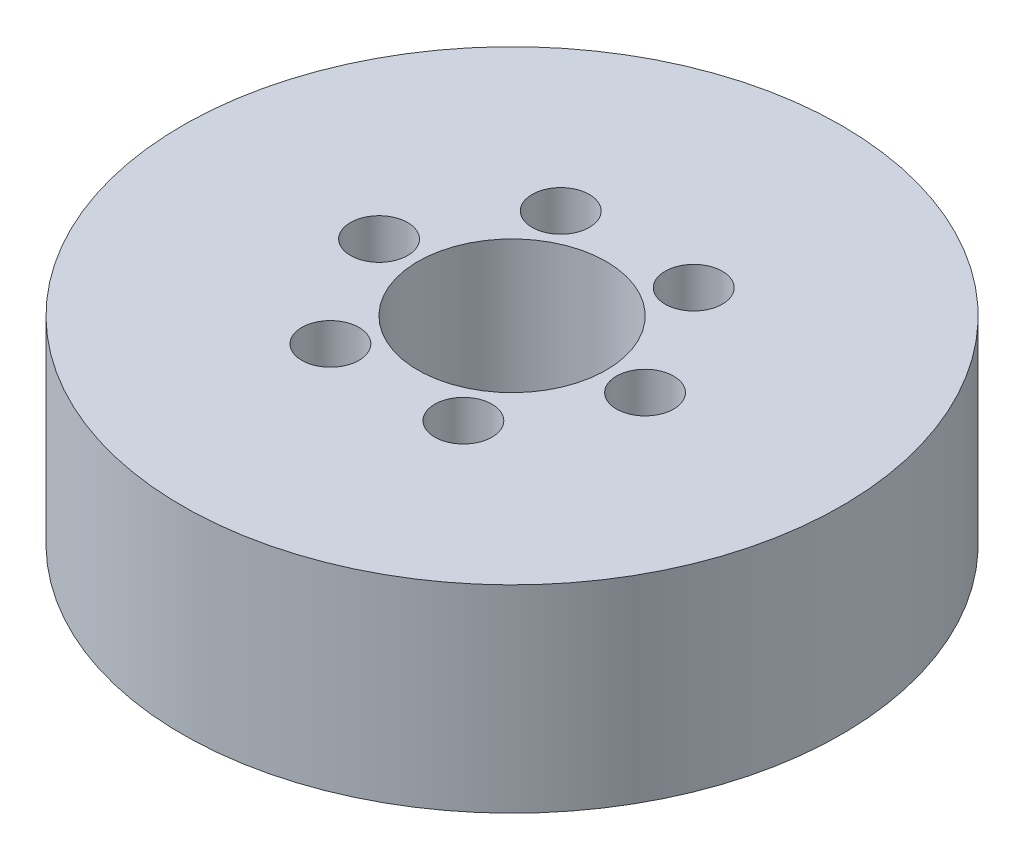
from build123d import *

# Parameters (mm, degrees)
SKETCH1_R           = 35
BOSS_EXTRUDE1_DEPTH = 21
SKETCH2_R           = 10
CUT_EXTRUDE1_DEPTH  = 54.768020235
SKETCH3_R           = 3.037598175
CUT_EXTRUDE2_DEPTH  = 18.811832248
CIRPATTERN1_COUNT   = 6


with BuildPart() as part:
    # Sketch1 → Boss-Extrude1 (new body)
    with BuildSketch(Plane(origin=(0, 0, 0), x_dir=(1, 0, 0), z_dir=(0, 1, 0))):
        Circle(SKETCH1_R)
    extrude(amount=BOSS_EXTRUDE1_DEPTH)

    # Sketch2 → Cut-Extrude1 (cut, through all)
    with BuildSketch(Plane(origin=(0, 0, 0), x_dir=(1, 0, 0), z_dir=(0, 1, 0))):
        Circle(SKETCH2_R)
    extrude(amount=CUT_EXTRUDE1_DEPTH, mode=Mode.SUBTRACT)

    # Sketch3 → Cut-Extrude2 (cut)
    with BuildSketch(Plane(origin=(0, 21, 0), x_dir=(1, 0, 0), z_dir=(0, 1, 0))):
        with Locations((-14.123450794, 0)):
            Circle(SKETCH3_R)
    cut_extrude2 = extrude(amount=-CUT_EXTRUDE2_DEPTH, mode=Mode.SUBTRACT)

    # CirPattern1: Cut-Extrude2 ×6 about axis
    cirpattern1_axis = Axis((0, 0, 0), (0, 1, 0))
    for i in range(1, CIRPATTERN1_COUNT):
        add(cut_extrude2.rotate(cirpattern1_axis, i * 360 / CIRPATTERN1_COUNT), mode=Mode.SUBTRACT)


solid = part.part
